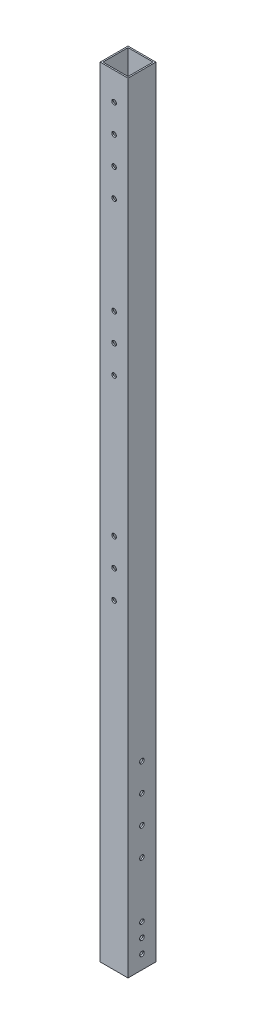
from build123d import *

# Parameters (mm, degrees)
SKETCH_1_W          = 20
SKETCH_1_H          = 20
SKETCH_1_W_2        = 18
SKETCH_1_H_2        = 18
EXTRUDE_1_DEPTH     = 740
SKETCH_3_R          = 1.65
CUT_EXTRUDE_1_DEPTH = 32
SKETCH_4_R          = 1.65
CUT_EXTRUDE_2_DEPTH = 741.337760755
SKETCH_5_R          = 14.566227152
CUT_EXTRUDE_3_DEPTH = 180
SKETCH_6_R          = 1.65
CUT_EXTRUDE_4_DEPTH = 30


with BuildPart() as part:
    # 草图1 → 凸台-拉伸1 (new body)
    with BuildSketch(Plane(origin=(0, 0, 0), x_dir=(1, 0, 0), z_dir=(0, 1, 0))):
        Rectangle(SKETCH_1_W, SKETCH_1_H)
        Rectangle(SKETCH_1_W_2, SKETCH_1_H_2, mode=Mode.SUBTRACT)
    extrude(amount=EXTRUDE_1_DEPTH)

    # 草图3 → 切除-拉伸1 (cut)
    with BuildSketch(Plane.XY.offset(10)):
        with Locations((0, 720)):
            Circle(SKETCH_3_R)
        with Locations((0, 700)):
            Circle(SKETCH_3_R)
        with Locations((0, 680)):
            Circle(SKETCH_3_R)
        with Locations((0, 660)):
            Circle(SKETCH_3_R)
        with Locations((0, 590)):
            Circle(SKETCH_3_R)
        with Locations((0, 570)):
            Circle(SKETCH_3_R)
        with Locations((0, 550)):
            Circle(SKETCH_3_R)
        with Locations((0, 450)):
            Circle(SKETCH_3_R)
        with Locations((0, 430)):
            Circle(SKETCH_3_R)
        with Locations((0, 410)):
            Circle(SKETCH_3_R)
    extrude(amount=-CUT_EXTRUDE_1_DEPTH, mode=Mode.SUBTRACT)

    # 草图4 → 切除-拉伸2 (cut, through all)
    with BuildSketch(Plane(origin=(10, 0, 0), x_dir=(0, 0, -1), z_dir=(1, 0, 0))):
        with Locations((0, 250)):
            Circle(SKETCH_4_R)
        with Locations((0, 270)):
            Circle(SKETCH_4_R)
        with Locations((0, 290)):
            Circle(SKETCH_4_R)
        with Locations((0, 310)):
            Circle(SKETCH_4_R)
    extrude(amount=-CUT_EXTRUDE_2_DEPTH, mode=Mode.SUBTRACT)

    # 草图5 → 切除-拉伸3 (cut)
    with BuildSketch(Plane.XZ):
        Circle(SKETCH_5_R)
    extrude(amount=-CUT_EXTRUDE_3_DEPTH, mode=Mode.SUBTRACT)

    # 草图6 → 切除-拉伸4 (cut)
    with BuildSketch(Plane(origin=(10, 0, 0), x_dir=(0, 0, -1), z_dir=(1, 0, 0))):
        with Locations((0, 190)):
            Circle(SKETCH_6_R)
        with Locations((0, 200)):
            Circle(SKETCH_6_R)
        with Locations((0, 210)):
            Circle(SKETCH_6_R)
    extrude(amount=-CUT_EXTRUDE_4_DEPTH, mode=Mode.SUBTRACT)


solid = part.part
